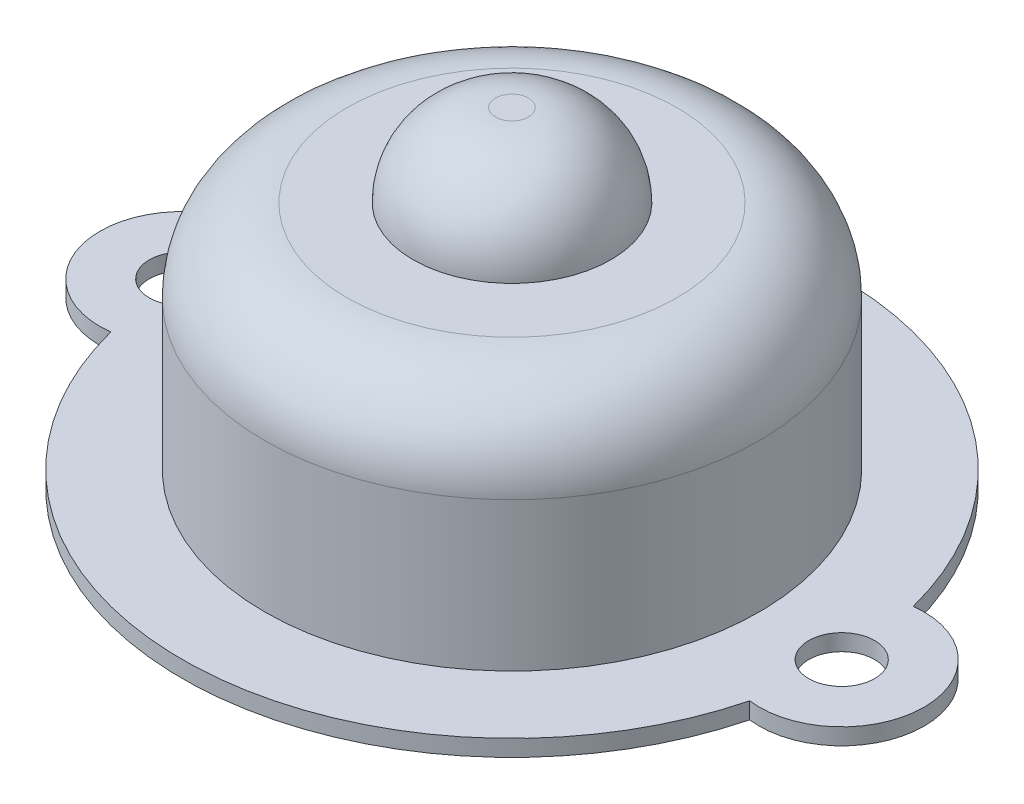
from build123d import *

# Parameters (mm, degrees)
SKETCH1_R           = 2
BOSS_EXTRUDE1_DEPTH = 1
SKETCH2_R           = 15
BOSS_EXTRUDE2_DEPTH = 14
FILLET1_R           = 5
SKETCH3_R           = 6
BOSS_EXTRUDE3_DEPTH = 5
FILLET2_R           = 5


with BuildPart() as part:
    # Sketch1 → Boss-Extrude1 (new body)
    with BuildSketch(Plane(origin=(0, 0, 0), x_dir=(1, 0, 0), z_dir=(0, 1, 0))):
        with BuildLine():
            ThreePointArc((-19.375, -4.960783708), (0, -20), (19.375, -4.960783708))
            ThreePointArc((19.375, -4.960783708), (25, 0), (19.375, 4.960783708))
            ThreePointArc((19.375, 4.960783708), (0, 20), (-19.375, 4.960783708))
            ThreePointArc((-19.375, 4.960783708), (-25, 0), (-19.375, -4.960783708))
        make_face()
        with Locations(Location((-20, 0, 0), (0, 0, 270))):
            Circle(SKETCH1_R, mode=Mode.SUBTRACT)
        with Locations(Location((20, 0, 0), (0, 0, 270))):
            Circle(SKETCH1_R, mode=Mode.SUBTRACT)
    extrude(amount=BOSS_EXTRUDE1_DEPTH)

    # Sketch2 → Boss-Extrude2 (add)
    with BuildSketch(Plane(origin=(0, 1, 0), x_dir=(1, 0, 0), z_dir=(0, 1, 0))):
        with Locations(Location((0, 0, 0), (0, 0, 270))):
            Circle(SKETCH2_R)
    extrude(amount=BOSS_EXTRUDE2_DEPTH)

    # Fillet1
    fillet1_edges = [part.edges().sort_by_distance(p)[0] for p in [
        (0, 15, -15),
    ]]
    fillet(fillet1_edges, radius=FILLET1_R)

    # Sketch3 → Boss-Extrude3 (add)
    with BuildSketch(Plane(origin=(0, 15, 0), x_dir=(1, 0, 0), z_dir=(0, 1, 0))):
        with Locations(Location((0, 0, 0), (0, 0, 270))):
            Circle(SKETCH3_R)
    extrude(amount=BOSS_EXTRUDE3_DEPTH)

    # Fillet2
    fillet2_edges = [part.edges().sort_by_distance(p)[0] for p in [
        (0, 20, -6),
    ]]
    fillet(fillet2_edges, radius=FILLET2_R - 0.0001)  # a hair under: the kernel refuses the full size


solid = part.part
